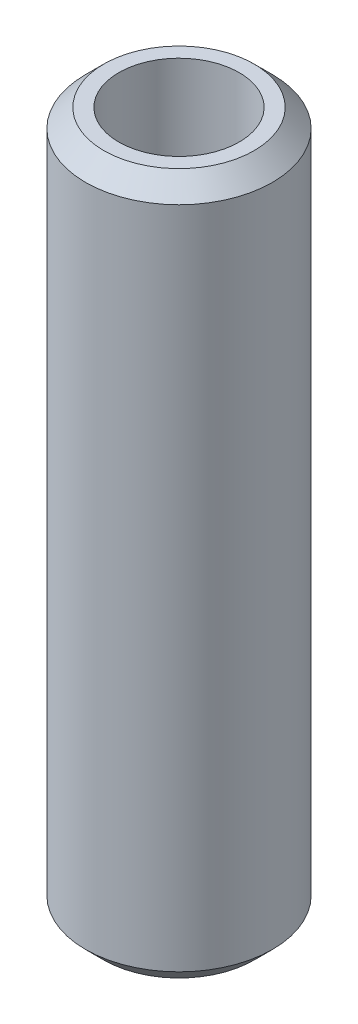
from build123d import *

# Parameters (mm, degrees)
SKETCH1_R           = 12.5
BOSS_EXTRUDE1_DEPTH = 93.768227362
SKETCH2_R           = 8.054048563
CUT_EXTRUDE1_DEPTH  = 96.420021289
CHAMFER1_SIZE       = 2.451507597


with BuildPart() as part:
    # Sketch1 → Boss-Extrude1 (new body)
    with BuildSketch(Plane(origin=(0, 0, 0), x_dir=(1, 0, 0), z_dir=(0, 1, 0))):
        Circle(SKETCH1_R)
    extrude(amount=BOSS_EXTRUDE1_DEPTH)

    # Sketch2 → Cut-Extrude1 (cut, through all)
    with BuildSketch(Plane(origin=(0, 0, 0), x_dir=(1, 0, 0), z_dir=(0, 1, 0))):
        Circle(SKETCH2_R)
    extrude(amount=CUT_EXTRUDE1_DEPTH, mode=Mode.SUBTRACT)

    # Chamfer1
    chamfer1_edges = [part.edges().sort_by_distance(p)[0] for p in [
        (-12.5, 93.768227362, 0),
        (-12.5, 0, 0),
    ]]
    chamfer(chamfer1_edges, length=CHAMFER1_SIZE)


solid = part.part
